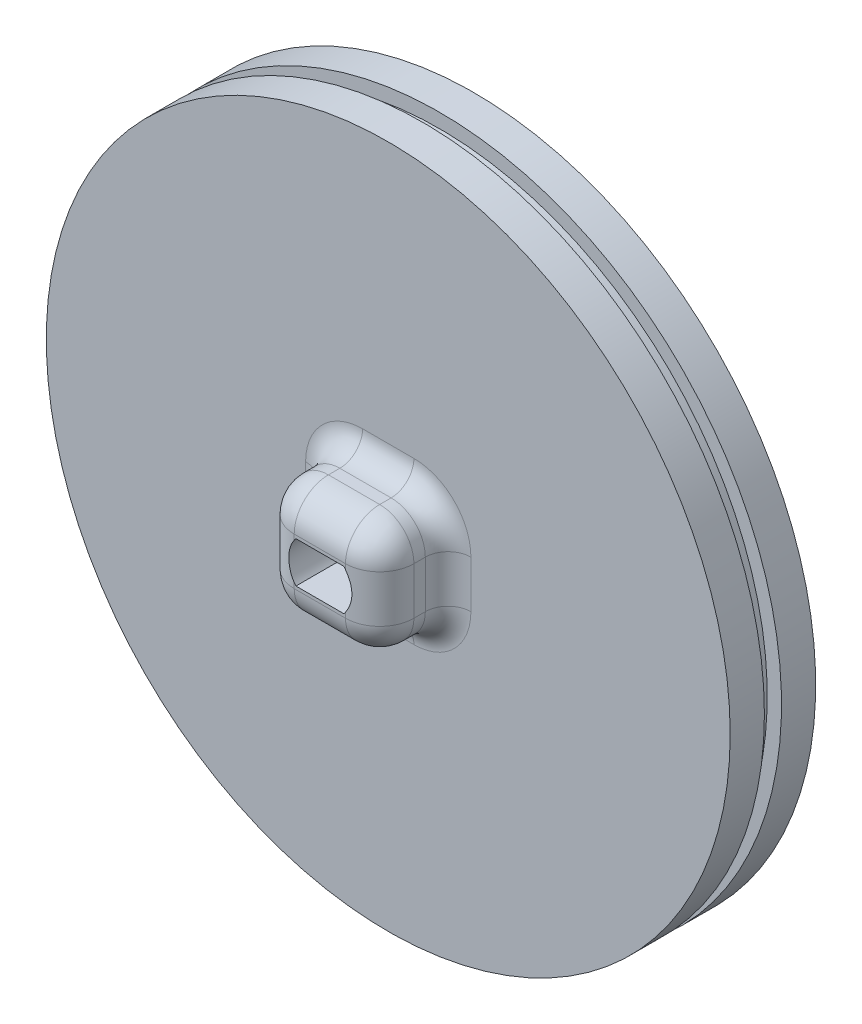
from build123d import *

# Parameters (mm, degrees)
ESQUISSE2_R             = 30
BOSS_EXTRU_1_DEPTH      = 3
ENL_V_MAT_EXTRU_1_DEPTH = 43.532340636
BOSS_EXTRU_3_START      = 6
ESQUISSE5_W             = 10.501413836
ESQUISSE5_H             = 10.144569676
BOSS_EXTRU_3_DEPTH      = 6
ESQUISSE8_R             = 28.75
BOSS_EXTRU_4_DEPTH      = 1.5
BOSS_EXTRU_5_START      = 3
ESQUISSE9_R             = 30
BOSS_EXTRU_5_DEPTH      = 3
ENL_V_MAT_EXTRU_4_DEPTH = 44.370496884
CONG_1_R                = 3
CONG_2_R                = 2


with BuildPart() as part:
    # Esquisse2 → Boss.-Extru.1 (new body)
    with BuildSketch(Plane.XY):
        Circle(ESQUISSE2_R)
    extrude(amount=BOSS_EXTRU_1_DEPTH)

    # Esquisse4 → Enlèv. mat.-Extru.1 (cut, through all)
    with BuildSketch(Plane.XY.offset(3)):
        with BuildLine():
            Line((-2.1, -1.8), (2.1, -1.8))
            ThreePointArc((2.1, -1.8), (2.765863337, 0), (2.1, 1.8))
            Line((2.1, 1.8), (-2.1, 1.8))
            ThreePointArc((-2.1, 1.8), (-2.765863337, 0), (-2.1, -1.8))
        make_face()
    extrude(amount=-ENL_V_MAT_EXTRU_1_DEPTH, mode=Mode.SUBTRACT)

    # Esquisse5 → Boss.-Extru.3 (add)
    with BuildSketch(Plane.XY.offset(3).offset(BOSS_EXTRU_3_START)):
        Rectangle(ESQUISSE5_W, ESQUISSE5_H)
        with BuildLine():
            Line((-2.1, 1.8), (2.1, 1.8))
            ThreePointArc((2.1, 1.8), (2.765863337, 0), (2.1, -1.8))
            Line((2.1, -1.8), (-2.1, -1.8))
            ThreePointArc((-2.1, -1.8), (-2.765863337, 0), (-2.1, 1.8))
        make_face(mode=Mode.SUBTRACT)
    extrude(amount=-BOSS_EXTRU_3_DEPTH)

    # Esquisse8 → Boss.-Extru.4 (add)
    with BuildSketch(Plane(origin=(0, 0, 0), x_dir=(-1, 0, 0), z_dir=(0, 0, -1))):
        Circle(ESQUISSE8_R)
    extrude(amount=BOSS_EXTRU_4_DEPTH)

    # Esquisse9 → Boss.-Extru.5 (add)
    with BuildSketch(Plane(origin=(0, 0, -1.5), x_dir=(-1, 0, 0), z_dir=(0, 0, -1)).offset(BOSS_EXTRU_5_START)):
        with Locations(Location((0, 0, 0), (0, 0, 180))):
            Circle(ESQUISSE9_R)
    extrude(amount=-BOSS_EXTRU_5_DEPTH)

    # Esquisse10 → Enlèv. mat.-Extru.4 (cut, through all)
    with BuildSketch(Plane.XY):
        with BuildLine():
            Line((-2.1, 1.8), (2.1, 1.8))
            ThreePointArc((2.1, 1.8), (2.765863337, 0), (2.1, -1.8))
            Line((2.1, -1.8), (-2.1, -1.8))
            ThreePointArc((-2.1, -1.8), (-2.765863337, 0), (-2.1, 1.8))
        make_face()
    extrude(amount=-ENL_V_MAT_EXTRU_4_DEPTH, mode=Mode.SUBTRACT)

    # Congé1
    # the kernel refuses this fillet: 3 mm, written as the material it takes off along each edge
    with BuildSketch(Plane(origin=(-2.250706918, -2.072284838, 6), x_dir=(-1, 0, 0), z_dir=(0, -1, 0))) as cong_1_piece_1_section:
        Polygon((0, 0), (CONG_1_R, 0), (CONG_1_R, -CONG_1_R), (0, -CONG_1_R), align=None)
    cong_1_piece_1 = extrude(amount=CONG_1_R, mode=Mode.PRIVATE)
    cong_1_piece_1 = cong_1_piece_1 - Plane(origin=(-2.250706918, -2.072284838, 6), x_dir=(0.7071067811865475, 0, -0.7071067811865475), z_dir=(0, -1, 0)) * Sphere(CONG_1_R, mode=Mode.PRIVATE)
    add(cong_1_piece_1, mode=Mode.SUBTRACT)
    with BuildSketch(Plane(origin=(-2.250706918, 2.072284838, 6), x_dir=(-1, 0, 0), z_dir=(0, 1, 0))) as cong_1_piece_2_section:
        Polygon((0, 0), (CONG_1_R, 0), (CONG_1_R, CONG_1_R), (0, CONG_1_R), align=None)
    cong_1_piece_2 = extrude(amount=CONG_1_R, mode=Mode.PRIVATE)
    cong_1_piece_2 = cong_1_piece_2 - Plane(origin=(-2.250706918, 2.072284838, 6), x_dir=(0.7071067811865475, 0, -0.7071067811865475), z_dir=(0, 1, 0)) * Sphere(CONG_1_R, mode=Mode.PRIVATE)
    add(cong_1_piece_2, mode=Mode.SUBTRACT)
    with BuildSketch(Plane(origin=(2.250706918, -2.072284838, 6), x_dir=(0, -1, 0), z_dir=(1, 0, 0))) as cong_1_piece_3_section:
        Polygon((0, 0), (CONG_1_R, 0), (CONG_1_R, -CONG_1_R), (0, -CONG_1_R), align=None)
    cong_1_piece_3 = extrude(amount=CONG_1_R, mode=Mode.PRIVATE)
    cong_1_piece_3 = cong_1_piece_3 - Plane(origin=(2.250706918, -2.072284838, 6), x_dir=(0, 0.7071067811865475, -0.7071067811865475), z_dir=(1, 0, 0)) * Sphere(CONG_1_R, mode=Mode.PRIVATE)
    add(cong_1_piece_3, mode=Mode.SUBTRACT)
    with BuildSketch(Plane(origin=(2.250706918, 2.072284838, 6), x_dir=(1, 0, 0), z_dir=(0, 1, 0))) as cong_1_piece_4_section:
        Polygon((0, 0), (CONG_1_R, 0), (CONG_1_R, -CONG_1_R), (0, -CONG_1_R), align=None)
    cong_1_piece_4 = extrude(amount=CONG_1_R, mode=Mode.PRIVATE)
    cong_1_piece_4 = cong_1_piece_4 - Plane(origin=(2.250706918, 2.072284838, 6), x_dir=(-0.7071067811865475, 0, -0.7071067811865475), z_dir=(0, 1, 0)) * Sphere(CONG_1_R, mode=Mode.PRIVATE)
    add(cong_1_piece_4, mode=Mode.SUBTRACT)
    with BuildSketch(Plane(origin=(-5.250706918, -2.072284838, 9), x_dir=(0, 0, -1), z_dir=(0, 1, 0))) as cong_1_piece_5:
        with BuildLine():
            CenterArc((CONG_1_R, -CONG_1_R), CONG_1_R, 90, 90)
            Line((0, -CONG_1_R), (0, 0))
            Line((0, 0), (CONG_1_R, 0))
        make_face()
    extrude(amount=4.144569676, mode=Mode.SUBTRACT)
    with BuildSketch(Plane(origin=(-5.250706918, 5.072284838, 6), x_dir=(0, -1, 0), z_dir=(0, 0, -1)), Plane(origin=(5.250706918, -5.072284838, 6), x_dir=(0, 1, 0), z_dir=(0, 0, -1)), Plane(origin=(5.250706918, 5.072284838, 6), x_dir=(-1, 0, 0), z_dir=(0, 0, -1))) as cong_1_piece_6:
        with BuildLine():
            CenterArc((CONG_1_R, -CONG_1_R), CONG_1_R, 90, 90)
            Line((0, -CONG_1_R), (0, 0))
            Line((0, 0), (CONG_1_R, 0))
        make_face()
    extrude(amount=3, mode=Mode.SUBTRACT)
    with BuildSketch(Plane(origin=(2.250706918, -5.072284838, 9), x_dir=(0, 1, 0), z_dir=(-1, 0, 0)), Plane(origin=(-2.250706918, 5.072284838, 9), x_dir=(0, -1, 0), z_dir=(1, 0, 0))) as cong_1_piece_7:
        with BuildLine():
            CenterArc((CONG_1_R, CONG_1_R), CONG_1_R, 180, 90)
            Line((0, CONG_1_R), (0, 0))
            Line((0, 0), (CONG_1_R, 0))
        make_face()
    extrude(amount=4.501413836, mode=Mode.SUBTRACT)
    with BuildSketch(Plane(origin=(-5.250706918, -5.072284838, 6), x_dir=(0, 1, 0), z_dir=(0, 0, -1))) as cong_1_piece_8:
        with BuildLine():
            CenterArc((CONG_1_R, CONG_1_R), CONG_1_R, 180, 90)
            Line((0, CONG_1_R), (0, 0))
            Line((0, 0), (CONG_1_R, 0))
        make_face()
    extrude(amount=3, mode=Mode.SUBTRACT)
    with BuildSketch(Plane(origin=(5.250706918, 2.072284838, 9), x_dir=(-1, 0, 0), z_dir=(0, -1, 0))) as cong_1_piece_9:
        with BuildLine():
            CenterArc((CONG_1_R, CONG_1_R), CONG_1_R, 180, 90)
            Line((0, CONG_1_R), (0, 0))
            Line((0, 0), (CONG_1_R, 0))
        make_face()
    extrude(amount=4.144569676, mode=Mode.SUBTRACT)

    # Congé2
    cong_2_edges = [part.edges().sort_by_distance(p)[0] for p in [
        (-5.250706918, 0, 3),
        (0, 5.072284838, 3),
        (0, -5.072284838, 3),
        (5.250706918, 0, 3),
        (-4.372027261, 4.193605182, 3),
        (-4.372027261, -4.193605182, 3),
        (4.372027261, -4.193605182, 3),
        (4.372027261, 4.193605182, 3),
    ]]
    fillet(cong_2_edges, radius=CONG_2_R)


solid = part.part
